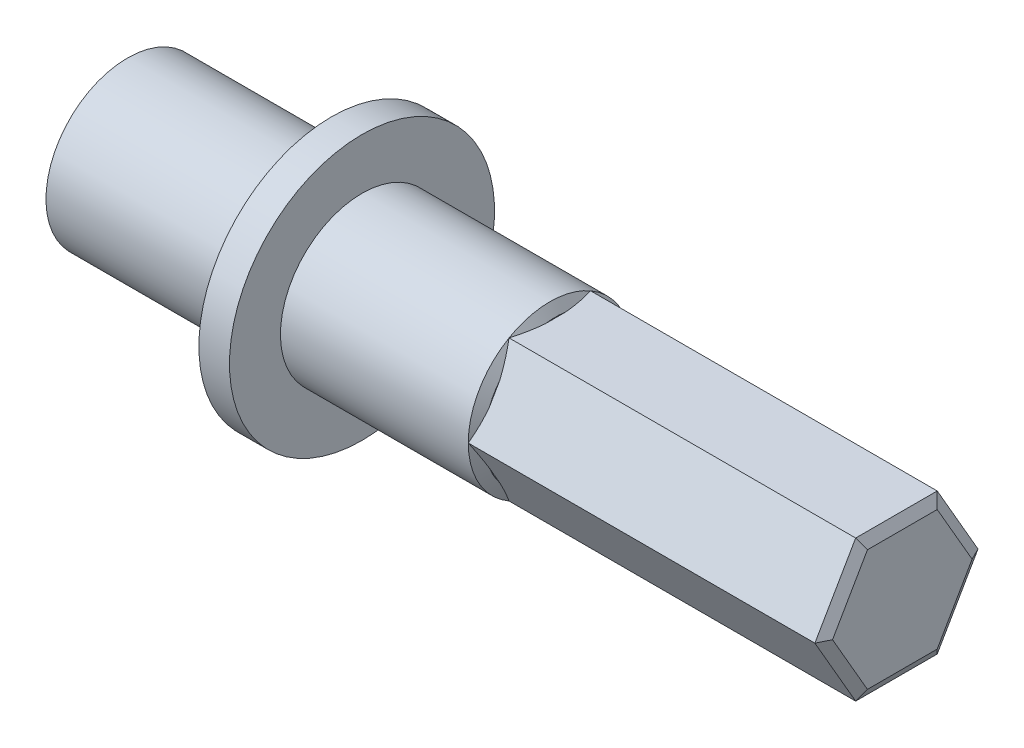
from build123d import *

# Parameters (mm, degrees)
CUT_EXTRUDE1_DEPTH = 17
CHAMFER1_SIZE      = 0.288675135
CHAMFER1_SIZE_2    = 0.5
CHAMFER2_SIZE      = 0.5
CHAMFER2_SIZE2     = 0.288675135


with BuildPart() as part:
    # Sketch2 → Revolve1 (revolve)
    with BuildSketch(Plane.XY):
        Polygon((0, 0), (-10, 0), (-10, 4), (0, 4), (0, 6.5), (1.5, 6.5), (1.5, 4), (28, 4), (28, 0), align=None)
    revolve(axis=Axis((28, 0, 0), (-1, 0, 0)))

    # Sketch3 → Cut-Extrude1 (cut)
    with BuildSketch(Plane(origin=(28, 0, 0), x_dir=(0, 0, -1), z_dir=(1, 0, 0))):
        with BuildLine():
            Line((-2, 3.464101615), (2, 3.464101615))
            ThreePointArc((2, 3.464101615), (0, 4), (-2, 3.464101615))
        make_face()
        with BuildLine():
            Line((2, 3.464101615), (4, 0))
            ThreePointArc((4, 0), (3.464101615, 2), (2, 3.464101615))
        make_face()
        with BuildLine():
            Line((-4, 0), (-2, 3.464101615))
            ThreePointArc((-2, 3.464101615), (-3.464101615, 2), (-4, 0))
        make_face()
        with BuildLine():
            ThreePointArc((-4, 0), (-3.464101615, -2), (-2, -3.464101615))
            Line((-2, -3.464101615), (-4, 0))
        make_face()
        with BuildLine():
            ThreePointArc((-2, -3.464101615), (0, -4), (2, -3.464101615))
            Line((2, -3.464101615), (-2, -3.464101615))
        make_face()
        with BuildLine():
            ThreePointArc((2, -3.464101615), (3.464101615, -2), (4, 0))
            Line((4, 0), (2, -3.464101615))
        make_face()
    extrude(amount=-CUT_EXTRUDE1_DEPTH, mode=Mode.SUBTRACT)

    # Chamfer1
    # the kernel refuses this chamfer: 0.5, 0.288675135 mm, written as the material it takes off along each edge
    with BuildSketch(Plane(origin=(11, 0, 0), x_dir=(0, -0.8660254037844389, -0.49999999999999956), z_dir=(0, -0.49999999999999956, 0.8660254037844389))) as chamfer1_piece_1_section:
        Polygon((4, -CHAMFER1_SIZE * 0.999999998596), (4 - CHAMFER1_SIZE_2, 0), (4, 0), align=None)
    chamfer1_piece_1 = revolve(axis=Axis((11, 0, 0), (1, 0, 0)), revolution_arc=60, mode=Mode.PRIVATE)
    chamfer1_piece_1 = split(chamfer1_piece_1, bisect_by=Plane(origin=(10.787249311, -3.461547111, -2.001474844), z_dir=(0, -0.4999999999999996, -0.8660254037844389)), keep=Keep.TOP, mode=Mode.PRIVATE)
    add(chamfer1_piece_1, mode=Mode.SUBTRACT)
    with BuildSketch(Plane(origin=(11, 0, 0), x_dir=(0, 0, 1), z_dir=(0, 1, 0))) as chamfer1_piece_2_section:
        Polygon((4, -CHAMFER1_SIZE * 0.999999998596), (4 - CHAMFER1_SIZE_2, 0), (4, 0), align=None)
    chamfer1_piece_2 = revolve(axis=Axis((11, 0, 0), (1, 0, 0)), revolution_arc=60, mode=Mode.PRIVATE)
    chamfer1_piece_2 = split(chamfer1_piece_2, bisect_by=Plane(origin=(10.787249311, -0.002554504, 3.998525156), z_dir=(0, -0.4999999999999999, 0.8660254037844387)), keep=Keep.TOP, mode=Mode.PRIVATE)
    add(chamfer1_piece_2, mode=Mode.SUBTRACT)
    with BuildSketch(Plane(origin=(11, 0, 0), x_dir=(0, 1, 0), z_dir=(0, 0, -1))) as chamfer1_piece_3_section:
        Polygon((4, -CHAMFER1_SIZE * 0.999999998596), (4 - CHAMFER1_SIZE_2, 0), (4, 0), align=None)
    chamfer1_piece_3 = revolve(axis=Axis((11, 0, 0), (1, 0, 0)), revolution_arc=30, mode=Mode.PRIVATE)
    chamfer1_piece_3 = split(chamfer1_piece_3, bisect_by=Plane(origin=(10.898935311, 3.464101615, 0.855614375), z_dir=(0, 1, 0)), keep=Keep.TOP, mode=Mode.PRIVATE)
    add(chamfer1_piece_3, mode=Mode.SUBTRACT)
    with BuildSketch(Plane(origin=(11, 0, 0), x_dir=(0, 0, -1), z_dir=(0, -1, 0))) as chamfer1_piece_4_section:
        Polygon((4, -CHAMFER1_SIZE * 0.999999998596), (4 - CHAMFER1_SIZE_2, 0), (4, 0), align=None)
    chamfer1_piece_4 = revolve(axis=Axis((11, 0, 0), (1, 0, 0)), revolution_arc=60, mode=Mode.PRIVATE)
    chamfer1_piece_4 = split(chamfer1_piece_4, bisect_by=Plane(origin=(10.787249311, 0.002554504, -3.998525156), z_dir=(0, 0.49999999999999983, -0.8660254037844388)), keep=Keep.TOP, mode=Mode.PRIVATE)
    add(chamfer1_piece_4, mode=Mode.SUBTRACT)
    with BuildSketch(Plane(origin=(11, 0, 0), x_dir=(0, 0.8660254037844386, 0.5000000000000003), z_dir=(0, 0.5000000000000003, -0.8660254037844386))) as chamfer1_piece_5_section:
        Polygon((4, -CHAMFER1_SIZE * 0.999999998596), (4 - CHAMFER1_SIZE_2, 0), (4, 0), align=None)
    chamfer1_piece_5 = revolve(axis=Axis((11, 0, 0), (1, 0, 0)), revolution_arc=60, mode=Mode.PRIVATE)
    chamfer1_piece_5 = split(chamfer1_piece_5, bisect_by=Plane(origin=(10.787249311, 3.461547111, 2.001474844), z_dir=(0, 0.5000000000000001, 0.8660254037844386)), keep=Keep.TOP, mode=Mode.PRIVATE)
    add(chamfer1_piece_5, mode=Mode.SUBTRACT)
    with BuildSketch(Plane(origin=(11, 0, 0), x_dir=(0, -0.8660254037844388, 0.4999999999999997), z_dir=(0, 0.4999999999999997, 0.8660254037844388))) as chamfer1_piece_6_section:
        Polygon((4, -CHAMFER1_SIZE * 0.999999998596), (4 - CHAMFER1_SIZE_2, 0), (4, 0), align=None)
    chamfer1_piece_6 = revolve(axis=Axis((11, 0, 0), (1, 0, 0)), revolution_arc=60, mode=Mode.PRIVATE)
    chamfer1_piece_6 = split(chamfer1_piece_6, bisect_by=Plane(origin=(10.787249311, -3.464101615, 1.997050313), z_dir=(0, -1, 0)), keep=Keep.TOP, mode=Mode.PRIVATE)
    add(chamfer1_piece_6, mode=Mode.SUBTRACT)
    with BuildSketch(Plane(origin=(11, 0, 0), x_dir=(0, 0.8660254037844385, -0.5000000000000003), z_dir=(0, -0.5000000000000003, -0.8660254037844385))) as chamfer1_piece_7_section:
        Polygon((4, -CHAMFER1_SIZE * 0.999999998596), (4 - CHAMFER1_SIZE_2, 0), (4, 0), align=None)
    chamfer1_piece_7 = revolve(axis=Axis((11, 0, 0), (1, 0, 0)), revolution_arc=30, mode=Mode.PRIVATE)
    chamfer1_piece_7 = split(chamfer1_piece_7, bisect_by=Plane(origin=(10.787249311, 3.464101615, -1.997050313), z_dir=(0, 1, 0)), keep=Keep.TOP, mode=Mode.PRIVATE)
    add(chamfer1_piece_7, mode=Mode.SUBTRACT)

    # Chamfer2
    chamfer2_edges = [part.edges().sort_by_distance(p)[0] for p in [
        (28, -1.732050808, -3),
        (28, -1.732050808, 3),
        (28, 3.464101615, 0),
        (28, 1.732050808, -3),
        (28, 1.732050808, 3),
        (28, -3.464101615, 0),
    ]]
    chamfer2_side = [part.faces().sort_by_distance(p)[0] for p in [
        (28, 0, 0),
    ]]
    chamfer(chamfer2_edges, length=CHAMFER2_SIZE, length2=CHAMFER2_SIZE2, reference=chamfer2_side[0])


solid = part.part
